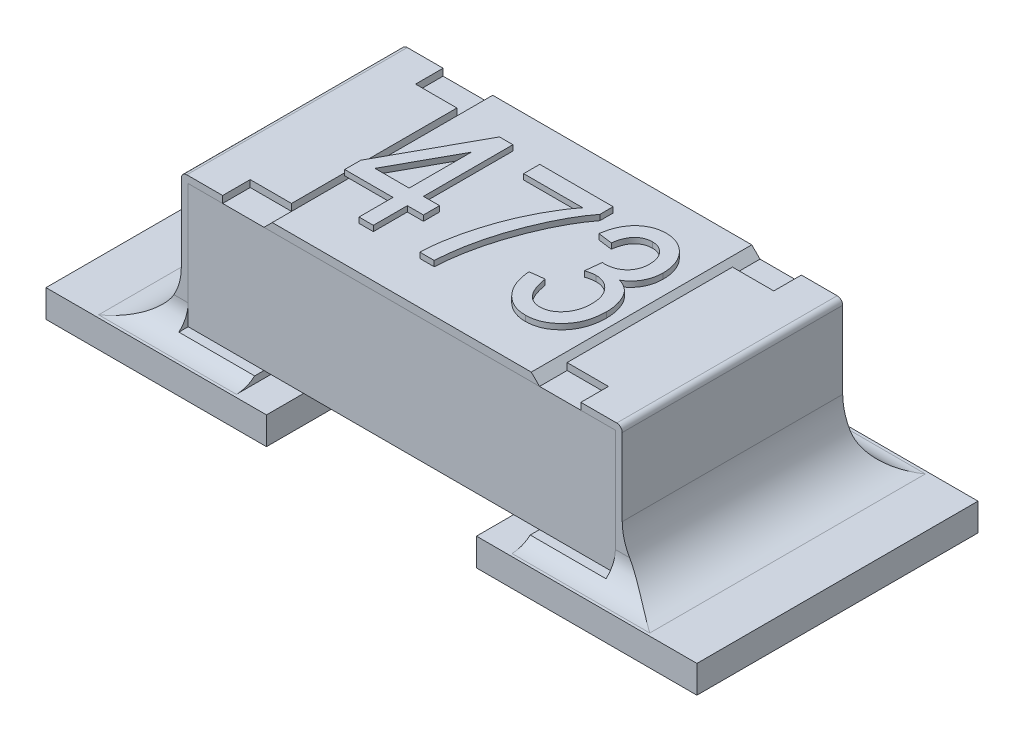
from build123d import *

# Parameters (mm, degrees)
SKETCH1_W             = 0.8
SKETCH1_H             = 0.45
BOSS_EXTRUDE1_DEPTH   = 0.775
BOSS_EXTRUDE2_DEPTH   = 0.4
BOSS_EXTRUDE2_2_DEPTH = 0.4
SKETCH3_W             = 0.15
SKETCH3_H             = 0.1
CUT_EXTRUDE1_DEPTH    = 0.025
BOSS_EXTRUDE3_DEPTH   = 0.4
SKETCH7_W             = 0.8
SKETCH7_H             = 1.02
BOSS_EXTRUDE5_DEPTH   = 0.1
FILLET3_R             = 0.2
FILLET4_R             = 0.2
FILLET5_R             = 0.1
FILLET6_R             = 0.1
BOSS_EXTRU_1_DEPTH    = 0.02


with BuildPart() as part:
    # Sketch1 → Boss-Extrude1 (new, symmetric)
    with BuildSketch(Plane(origin=(0, 0, 0), x_dir=(0, 0, -1), z_dir=(1, 0, 0))):
        with Locations((0, 0.35)):
            Rectangle(SKETCH1_W, SKETCH1_H)
    extrude(amount=BOSS_EXTRUDE1_DEPTH, both=True)


with BuildPart() as body_2:
    # Sketch2 → Boss-Extrude2 (new, symmetric)
    with BuildSketch(Plane.XY):
        with BuildLine():
            Line((-0.5, 0.6), (-0.78, 0.6))
            ThreePointArc((-0.78, 0.6), (-0.794142136, 0.594142136), (-0.8, 0.58))
            Line((-0.8, 0.58), (-0.8, 0.1))
            Line((-0.8, 0.1), (-0.5, 0.1))
            Line((-0.5, 0.1), (-0.5, 0.125))
            Line((-0.5, 0.125), (-0.775, 0.125))
            Line((-0.775, 0.125), (-0.775, 0.575))
            Line((-0.775, 0.575), (-0.5, 0.575))
            Line((-0.5, 0.575), (-0.5, 0.6))
        make_face()
    extrude(amount=BOSS_EXTRUDE2_DEPTH, both=True)


with BuildPart() as body_3:
    # Sketch2 → Boss-Extrude2 2 (new, symmetric)
    with BuildSketch(Plane.XY):
        with BuildLine():
            Line((0.5, 0.575), (0.5, 0.6))
            Line((0.5, 0.6), (0.78, 0.6))
            ThreePointArc((0.78, 0.6), (0.794142136, 0.594142136), (0.8, 0.58))
            Line((0.8, 0.58), (0.8, 0.1))
            Line((0.8, 0.1), (0.5, 0.1))
            Line((0.5, 0.1), (0.5, 0.125))
            Line((0.5, 0.125), (0.775, 0.125))
            Line((0.775, 0.125), (0.775, 0.575))
            Line((0.775, 0.575), (0.5, 0.575))
        make_face()
    extrude(amount=BOSS_EXTRUDE2_2_DEPTH, both=True)


with BuildPart() as cut_extrude1_tool:
    # Sketch3 → Cut-Extrude1 (new body)
    with BuildSketch(Plane(origin=(0, 0.6, 0), x_dir=(1, 0, 0), z_dir=(0, 1, 0))):
        with Locations((-0.575, 0.35)):
            Rectangle(SKETCH3_W, SKETCH3_H)
        with Locations((-0.575, -0.35)):
            Rectangle(SKETCH3_W, SKETCH3_H)
        with Locations((0.575, -0.35)):
            Rectangle(SKETCH3_W, SKETCH3_H)
        with Locations((0.575, 0.35)):
            Rectangle(SKETCH3_W, SKETCH3_H)
    extrude(amount=-CUT_EXTRUDE1_DEPTH)


with BuildPart() as body_2_1:
    add(body_2.part)

    # Cut-Extrude1: cut by cut_extrude1_tool
    add(cut_extrude1_tool.part, mode=Mode.SUBTRACT)



with BuildPart() as body_3_1:
    add(body_3.part)

    # Cut-Extrude1: cut by cut_extrude1_tool
    add(cut_extrude1_tool.part, mode=Mode.SUBTRACT)


with BuildPart() as body_4:
    # Sketch4 → Boss-Extrude3 (new, symmetric)
    with BuildSketch(Plane.XY):
        Polygon((-0.5, 0.575), (0.5, 0.575), (0.47, 0.605), (-0.47, 0.605), align=None)
    extrude(amount=BOSS_EXTRUDE3_DEPTH, both=True)

    # Esquisse2 → Boss.-Extru.1 (add)
    # profile 1 of 3: a face of its own
    with BuildSketch(Plane(origin=(0, 0.605, 0), x_dir=(1, 0, 0), z_dir=(0, 1, 0))):
        Polygon((-0.309886691, -0.245221888), (-0.309886691, -0.121845264), (-0.485211367, -0.121845264), (-0.485211367, -0.063403706), (-0.306944321, 0.261271619), (-0.257938639, 0.261271619), (-0.257938639, -0.063403706), (-0.199497081, -0.063403706), (-0.199497081, -0.121845264), (-0.257938639, -0.121845264), (-0.257938639, -0.245221888), align=None)
        Polygon((-0.309886691, -0.063403706), (-0.309886691, 0.162550028), (-0.433973542, -0.063403706), align=None, mode=Mode.SUBTRACT)
    # profile 2 of 3: a face of its own
    with BuildSketch(Plane(origin=(0, 0.605, 0), x_dir=(1, 0, 0), z_dir=(0, 1, 0))):
        with BuildLine():
            Line((-0.147549029, 0.189843048), (-0.147549029, 0.248284606))
            Line((-0.147549029, 0.248284606), (0.118684737, 0.248284606))
            Line((0.118684737, 0.248284606), (0.118684737, 0.200496457))
            add(Edge.make_bspline(
                [(0.118684737, 0.200496457), (0.11374506, 0.193883112), (0.103690577, 0.180421956), (0.089629665, 0.15888939), (0.075954824, 0.135956865), (0.062653235, 0.111604996), (0.049881166, 0.085755524), (0.037509723, 0.058489528), (0.02565439, 0.029704454), (0.014307924, -0.000233926), (0.003675417, -0.030854621), (-0.005742033, -0.061692329), (-0.013988634, -0.092449334), (-0.020962495, -0.123124227), (-0.026905964, -0.153701204), (-0.031550699, -0.184233606), (-0.035053075, -0.21472856), (-0.036458112, -0.235069144), (-0.037159418, -0.245221888)],
                knots=[0, 0, 0, 0, 0.828235292, 1.685834407, 2.579347319, 3.50739146, 4.469751317, 5.472290501, 6.511687755, 7.593421113, 8.685056077, 9.764080991, 10.828622054, 11.880069368, 12.920502423, 13.954003105, 14.978766756, 16, 16, 16, 16], degree=3))
            Line((-0.037159418, -0.245221888), (-0.08910747, -0.245221888))
            add(Edge.make_bspline(
                [(-0.08910747, -0.245221888), (-0.088946966, -0.239876054), (-0.088619538, -0.228970553), (-0.087305949, -0.2122975), (-0.085650055, -0.194926574), (-0.083168557, -0.176934464), (-0.080118357, -0.158294079), (-0.076411626, -0.13902896), (-0.072322113, -0.11904052), (-0.065773685, -0.091649168), (-0.056543919, -0.057339348), (-0.043279746, -0.016938754), (-0.028326509, 0.022538381), (-0.011308019, 0.060586243), (0.006839864, 0.096834643), (0.025951357, 0.13052881), (0.045471344, 0.161610603), (0.059774471, 0.180599823), (0.066736685, 0.189843048)],
                knots=[0, 0, 0, 0, 0.54755489, 1.117011975, 1.712111195, 2.334110413, 2.976306168, 3.645990646, 4.342828197, 5.06521062, 6.529487471, 7.979439287, 9.417531512, 10.850025522, 12.245424871, 13.566691952, 14.815558909, 16, 16, 16, 16], degree=3))
            Line((0.066736685, 0.189843048), (-0.147549029, 0.189843048))
        make_face()
    # profile 3 of 3: a face of its own
    with BuildSketch(Plane(origin=(0, 0.605, 0), x_dir=(1, 0, 0), z_dir=(0, 1, 0))):
        with BuildLine():
            Line((0.170632789, -0.108858251), (0.222580841, -0.102364745))
            add(Edge.make_bspline(
                [(0.222580841, -0.102364745), (0.223250829, -0.106295854), (0.22455639, -0.113956147), (0.227125155, -0.124979634), (0.22992872, -0.135294754), (0.233178113, -0.144804398), (0.236720047, -0.153601456), (0.240647813, -0.161629834), (0.245039201, -0.16888819), (0.249786118, -0.175380729), (0.254903227, -0.181138198), (0.260367249, -0.186122883), (0.266229358, -0.190331218), (0.272433673, -0.193833451), (0.279078376, -0.196431554), (0.286032909, -0.198414424), (0.293399457, -0.199517263), (0.298436442, -0.199682771), (0.301010224, -0.199767342)],
                knots=[0, 0, 0, 0, 1.392235382, 2.712957193, 3.95076201, 5.123471921, 6.220028287, 7.260520794, 8.240826993, 9.178593426, 10.065213643, 10.926376853, 11.755607984, 12.580369742, 13.407158359, 14.241002189, 15.101193065, 16, 16, 16, 16], degree=3))
            add(Edge.make_bspline(
                [(0.301010224, -0.199767342), (0.303825283, -0.19971378), (0.309358329, -0.199608502), (0.31746663, -0.198040126), (0.325344292, -0.195898939), (0.332855478, -0.192563959), (0.340132453, -0.188466115), (0.347184329, -0.183522145), (0.353733984, -0.177410194), (0.360112096, -0.170691575), (0.365994713, -0.163232894), (0.371066918, -0.155086373), (0.37533871, -0.146371416), (0.378923333, -0.137192254), (0.381488545, -0.127399682), (0.383601675, -0.117188858), (0.384661656, -0.106343944), (0.384831463, -0.098950673), (0.384918504, -0.095161011)],
                knots=[0, 0, 0, 0, 0.904038564, 1.776903143, 2.648138989, 3.525264603, 4.411852617, 5.332561374, 6.2875971, 7.288147468, 8.311042921, 9.337403868, 10.368883854, 11.429611823, 12.501164111, 13.621320171, 14.780729868, 16, 16, 16, 16], degree=3))
            add(Edge.make_bspline(
                [(0.384918504, -0.095161011), (0.384826496, -0.091607761), (0.38464736, -0.084689696), (0.383662086, -0.074570464), (0.381856827, -0.064983483), (0.379159504, -0.05595494), (0.375965369, -0.047345761), (0.371888314, -0.03933172), (0.367077143, -0.031866947), (0.361634073, -0.025004423), (0.355624643, -0.018819667), (0.349286961, -0.013314715), (0.342518268, -0.008739927), (0.335489128, -0.004887872), (0.328007852, -0.002118976), (0.320292455, 8.4992e-05), (0.312175727, 0.00130226), (0.306661968, 0.001454003), (0.303851133, 0.001531359)],
                knots=[0, 0, 0, 0, 1.208507307, 2.352925112, 3.453685551, 4.520081629, 5.553915499, 6.572344605, 7.570902253, 8.569592363, 9.545641393, 10.499968035, 11.418701314, 12.319183888, 13.218416966, 14.125267075, 15.044288268, 16, 16, 16, 16], degree=3))
            add(Edge.make_bspline(
                [(0.303851133, 0.001531359), (0.301309415, 0.001451368), (0.29589117, 0.001280848), (0.287359372, -0.00019382), (0.277917334, -0.00226645), (0.271437206, -0.004300299), (0.268035387, -0.005367991)],
                knots=[0, 0, 0, 0, 0.832645691, 1.774971563, 2.831945141, 4, 4, 4, 4], degree=3))
            Line((0.268035387, -0.005367991), (0.274528893, 0.053479411))
            Line((0.274528893, 0.053479411), (0.282341393, 0.052769184))
            add(Edge.make_bspline(
                [(0.282341393, 0.052769184), (0.28535621, 0.052803375), (0.291239136, 0.052870094), (0.299843028, 0.054103025), (0.308050467, 0.05573649), (0.315778416, 0.058215582), (0.32312081, 0.06126306), (0.329963257, 0.06512583), (0.336430586, 0.069629935), (0.342407158, 0.074775592), (0.347772384, 0.080592975), (0.352565173, 0.086838036), (0.356526822, 0.093608382), (0.359818786, 0.100771608), (0.362342963, 0.108431244), (0.364185082, 0.116547048), (0.365164214, 0.125154849), (0.365345166, 0.131027254), (0.365437984, 0.134039476)],
                knots=[0, 0, 0, 0, 1.104467345, 2.155189185, 3.181695374, 4.170183668, 5.126157628, 6.092295424, 7.04536858, 8.012620263, 8.977961638, 9.942904556, 10.893715412, 11.848320646, 12.828840281, 13.845861792, 14.895045293, 16, 16, 16, 16], degree=3))
            add(Edge.make_bspline(
                [(0.365437984, 0.134039476), (0.365205154, 0.139435179), (0.364757695, 0.149804754), (0.361322938, 0.164574052), (0.355337719, 0.177647183), (0.347098304, 0.188824396), (0.337183227, 0.19783145), (0.326106912, 0.204581268), (0.31382294, 0.208580551), (0.305266447, 0.209072848), (0.300908763, 0.209323567)],
                knots=[0, 0, 0, 0, 1.168747258, 2.246123166, 3.262822778, 4.26410748, 5.234436762, 6.148309006, 7.056963545, 8, 8, 8, 8], degree=3))
            add(Edge.make_bspline(
                [(0.300908763, 0.209323567), (0.296380736, 0.209113033), (0.287572153, 0.208703473), (0.274976449, 0.204796436), (0.263388251, 0.198811303), (0.254940928, 0.191612698), (0.248954777, 0.184797154), (0.244731099, 0.179053945), (0.240977992, 0.172667561), (0.237797207, 0.165580977), (0.234735875, 0.157989828), (0.232570863, 0.149635141), (0.230408374, 0.14077154), (0.229528437, 0.134590959), (0.229074348, 0.131401489)],
                knots=[0, 0, 0, 0, 1.389180941, 2.702438466, 4.019316734, 5.377896697, 6.085434137, 6.807430375, 7.567469407, 8.358691296, 9.195188439, 10.081130764, 11.009773198, 12, 12, 12, 12], degree=3))
            Line((0.229074348, 0.131401489), (0.177126296, 0.137894996))
            add(Edge.make_bspline(
                [(0.177126296, 0.137894996), (0.177976911, 0.142845406), (0.179636207, 0.152502178), (0.183102865, 0.166397742), (0.187228647, 0.179379068), (0.19222398, 0.191374675), (0.197895954, 0.202488701), (0.204313267, 0.212674243), (0.211392332, 0.221998173), (0.219379085, 0.230202962), (0.227867658, 0.237510554), (0.236862982, 0.243821526), (0.246204676, 0.249253588), (0.256046714, 0.25362975), (0.26629668, 0.257099842), (0.277005895, 0.259528187), (0.288119335, 0.260963741), (0.2956624, 0.261168011), (0.299488309, 0.261271619)],
                knots=[0, 0, 0, 0, 1.259750421, 2.457396855, 3.589696629, 4.673763457, 5.713494597, 6.716289503, 7.690389722, 8.644478697, 9.583164327, 10.496506905, 11.397350125, 12.289843847, 13.194037124, 14.107891875, 15.040306322, 16, 16, 16, 16], degree=3))
            add(Edge.make_bspline(
                [(0.299488309, 0.261271619), (0.303519572, 0.261152706), (0.311450467, 0.260918763), (0.323107222, 0.259123737), (0.334317841, 0.256325888), (0.34505248, 0.252246796), (0.355215722, 0.246873647), (0.365057909, 0.240572938), (0.374413091, 0.233023939), (0.383134647, 0.224349983), (0.391140255, 0.214858231), (0.39816203, 0.204659864), (0.404193104, 0.193927052), (0.408982194, 0.18250432), (0.412725527, 0.170506984), (0.415460926, 0.157915535), (0.417135916, 0.144704426), (0.417301397, 0.135701715), (0.417386036, 0.131097106)],
                knots=[0, 0, 0, 0, 0.987546189, 1.94284647, 2.883618689, 3.814886987, 4.749064414, 5.696240478, 6.674807358, 7.688712876, 8.706405422, 9.713376545, 10.718845743, 11.717906576, 12.742863162, 13.794678478, 14.872046121, 16, 16, 16, 16], degree=3))
            add(Edge.make_bspline(
                [(0.417386036, 0.131097106), (0.417229743, 0.12553723), (0.416924506, 0.114678872), (0.413982335, 0.09892791), (0.409313119, 0.084150815), (0.402800714, 0.070445878), (0.394685499, 0.057883508), (0.384938112, 0.046771364), (0.373813758, 0.036921642), (0.365355289, 0.031747145), (0.361075159, 0.029128762)],
                knots=[0, 0, 0, 0, 1.090109576, 2.128968013, 3.132278696, 4.123864162, 5.09769889, 6.057339906, 7.016980922, 8, 8, 8, 8], degree=3))
            add(Edge.make_bspline(
                [(0.361075159, 0.029128762), (0.365006738, 0.027919056), (0.372688543, 0.025555446), (0.383286172, 0.020232713), (0.392949403, 0.014051368), (0.401583676, 0.006637104), (0.409263011, -0.002012587), (0.416120159, -0.011957767), (0.422011693, -0.023293485), (0.427334395, -0.035737208), (0.431505635, -0.049280075), (0.434710368, -0.063651321), (0.436527653, -0.078846612), (0.436751877, -0.089237754), (0.436866556, -0.094552245)],
                knots=[0, 0, 0, 0, 0.945190562, 1.846782401, 2.71900073, 3.580139159, 4.456653473, 5.37426406, 6.352713278, 7.392141409, 8.485180558, 9.608884637, 10.777077804, 12, 12, 12, 12], degree=3))
            add(Edge.make_bspline(
                [(0.436866556, -0.094552245), (0.436767054, -0.100206655), (0.436572795, -0.111245814), (0.434541302, -0.12742587), (0.431466768, -0.142815205), (0.427080999, -0.157468828), (0.421413591, -0.171273371), (0.414414732, -0.18430778), (0.406232011, -0.196573403), (0.396810932, -0.207898211), (0.386509539, -0.218037877), (0.375714857, -0.227099023), (0.364345387, -0.234700597), (0.352497961, -0.240980511), (0.340119591, -0.245749208), (0.327276517, -0.249234387), (0.313894434, -0.251292842), (0.304805128, -0.251573269), (0.300198536, -0.251715394)],
                knots=[0, 0, 0, 0, 1.16797173, 2.280242353, 3.364490462, 4.408173669, 5.436152277, 6.443028727, 7.460738993, 8.478233232, 9.481512989, 10.444418881, 11.386528098, 12.302557467, 13.209825675, 14.12198051, 15.04819242, 16, 16, 16, 16], degree=3))
            add(Edge.make_bspline(
                [(0.300198536, -0.251715394), (0.295930334, -0.251602688), (0.28752289, -0.25138068), (0.275179279, -0.249495111), (0.26333493, -0.246468911), (0.25203439, -0.242152829), (0.241145661, -0.236755504), (0.230837503, -0.230035031), (0.220981605, -0.222118498), (0.211720551, -0.213060002), (0.20325776, -0.202919877), (0.195571124, -0.191987861), (0.188819544, -0.180206271), (0.183323755, -0.167459779), (0.17862063, -0.15400335), (0.174859258, -0.139729734), (0.172100885, -0.124598771), (0.171128953, -0.11417798), (0.170632789, -0.108858251)],
                knots=[0, 0, 0, 0, 0.959274814, 1.889566238, 2.800731978, 3.703256649, 4.604498869, 5.528396462, 6.464265966, 7.442996794, 8.436156864, 9.429840861, 10.444772988, 11.483305447, 12.546329121, 13.647537524, 14.799087218, 16, 16, 16, 16], degree=3))
        make_face()
    extrude(amount=BOSS_EXTRU_1_DEPTH)


with BuildPart() as body_2_2:
    add(body_2_1.part)

    add(body_3_1.part)  # Boss-Extrude5 merges body 3
    # Sketch7 → Boss-Extrude5 (add)
    with BuildSketch(Plane(origin=(0, 0, 0), x_dir=(1, 0, 0), z_dir=(0, 1, 0))):
        with Locations((-0.781, 0)):
            Rectangle(SKETCH7_W, SKETCH7_H)
        with Locations((0.781, 0)):
            Rectangle(SKETCH7_W, SKETCH7_H)
    extrude(amount=BOSS_EXTRUDE5_DEPTH)

    # Fillet3
    fillet3_edges = [body_2_2.edges().sort_by_distance(p)[0] for p in [
        (-0.8, 0.1, 0),
    ]]
    fillet(fillet3_edges, radius=FILLET3_R)

    # Fillet4
    fillet4_edges = [body_2_2.edges().sort_by_distance(p)[0] for p in [
        (0.8, 0.1, 0),
    ]]
    fillet(fillet4_edges, radius=FILLET4_R)

    # Fillet5
    fillet5_edges = [body_2_2.edges().sort_by_distance(p)[0] for p in [
        (0.75, 0.1, 0.4),
    ]]
    fillet(fillet5_edges, radius=FILLET5_R)
    fillet5_2_edges = [body_2_2.edges().sort_by_distance(p)[0] for p in [
        (0.75, 0.1, -0.4),
    ]]
    fillet(fillet5_2_edges, radius=FILLET5_R)

    # Fillet6
    fillet6_edges = [body_2_2.edges().sort_by_distance(p)[0] for p in [
        (-0.75, 0.1, -0.4),
    ]]
    fillet(fillet6_edges, radius=FILLET6_R)
    fillet6_2_edges = [body_2_2.edges().sort_by_distance(p)[0] for p in [
        (-0.75, 0.1, 0.4),
    ]]
    fillet(fillet6_2_edges, radius=FILLET6_R)


solid = Compound([part.part, body_4.part, body_2_2.part])
